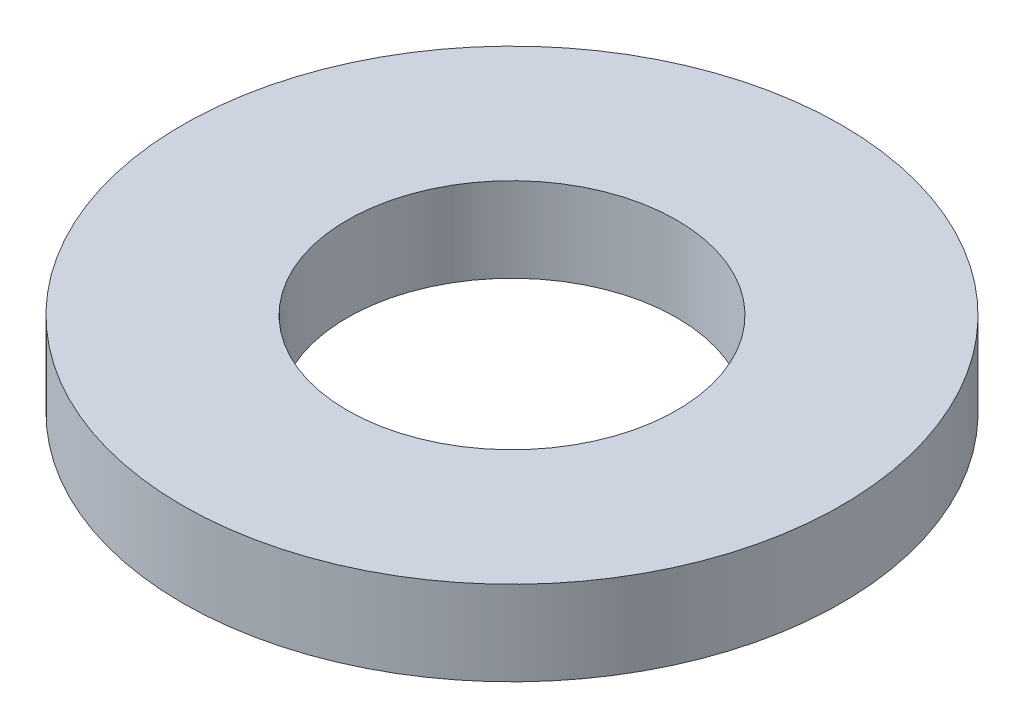
from build123d import *

# Parameters (mm, degrees)
SKETCH1_R           = 3.9624
BOSS_EXTRUDE1_DEPTH = 1.016
SKETCH5_R           = 1.9812
CUT_EXTRUDE1_DEPTH  = 6.695040256


with BuildPart() as part:
    # Sketch1 → Boss-Extrude1 (new body)
    with BuildSketch(Plane(origin=(0, 0, 0), x_dir=(1, 0, 0), z_dir=(0, 1, 0))):
        Circle(SKETCH1_R)
    extrude(amount=BOSS_EXTRUDE1_DEPTH)

    # Sketch5 → Cut-Extrude1 (cut, through all)
    with BuildSketch(Plane(origin=(0, 1.016, 0), x_dir=(-1, 0, 0), z_dir=(0, 1, 0))):
        Circle(SKETCH5_R)
    extrude(amount=-CUT_EXTRUDE1_DEPTH, mode=Mode.SUBTRACT)


solid = part.part
